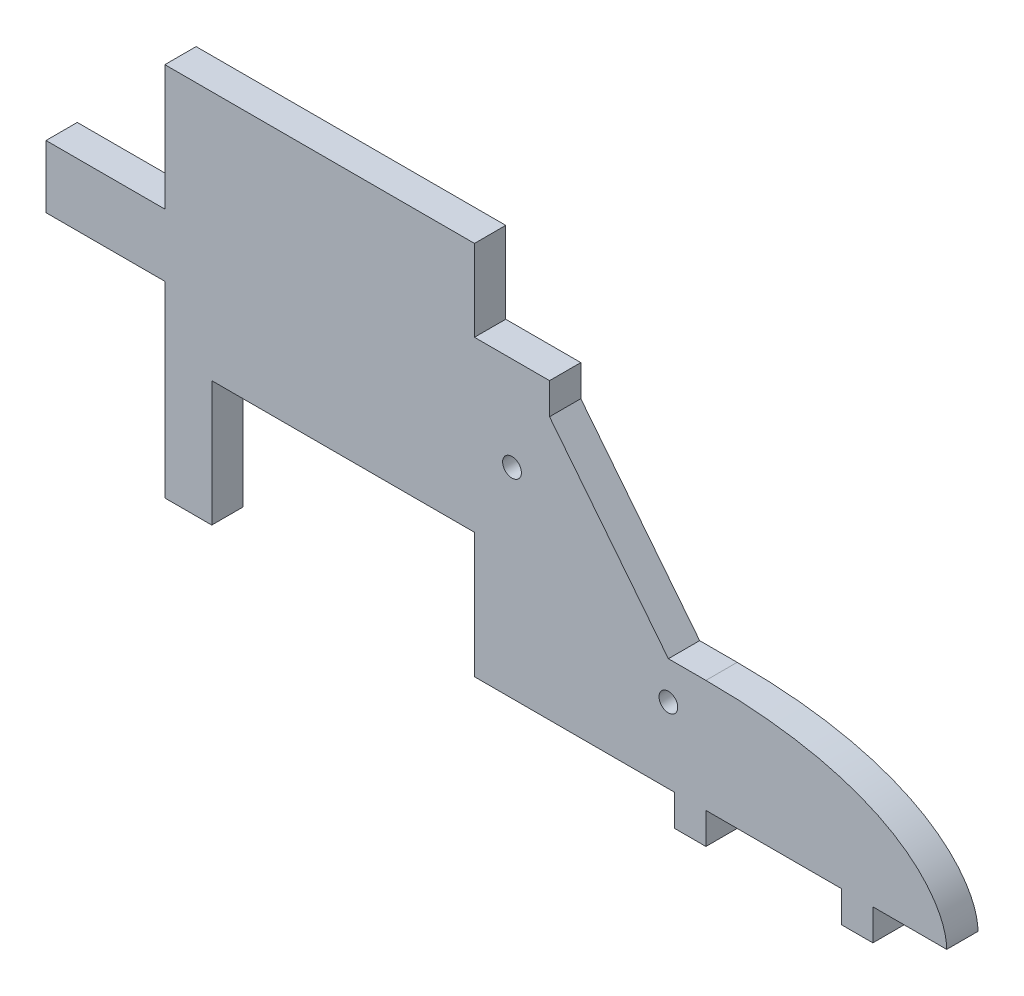
from build123d import *

# Parameters (mm, degrees)
ESQUISSE1_R             = 1.5
BOSS_EXTRU_1_DEPTH      = 5
BOSS_EXTRU_2_DEPTH      = 5
ESQUISSE3_W             = 236.288260714
ESQUISSE3_H             = 122.224262112
ENL_V_MAT_EXTRU_1_DEPTH = 5


with BuildPart() as part:
    # Esquisse1 → Boss.-Extru.1 (new body)
    with BuildSketch(Plane.XY):
        Polygon((12, 42), (31, 18), (37, 18), (37, 0), (37, -5), (32, -5), (32, 0), (0, 0), (0, 47), (12, 47), align=None)
        with Locations((6, 32)):
            Circle(ESQUISSE1_R, mode=Mode.SUBTRACT)
        with Locations((31, 12)):
            Circle(ESQUISSE1_R, mode=Mode.SUBTRACT)
    extrude(amount=BOSS_EXTRU_1_DEPTH)

    # Esquisse2 → Boss.-Extru.2 (add)
    with BuildSketch(Plane(origin=(0, 0, 0), x_dir=(-1, 0, 0), z_dir=(0, 0, -1))):
        with BuildLine():
            Line((-37, 0), (-58.692151967, 0))
            Line((-58.692151967, 0), (-58.692151967, -5))
            Line((-58.692151967, -5), (-63.692151967, -5))
            Line((-63.692151967, -5), (-63.692151967, 0))
            Line((-63.692151967, 0), (-75.5, 0))
            add(Edge.make_bspline(
                [(-75.5, 0), (-75.5, 5.982232529), (-67.685409636, 18), (-37, 18)],
                knots=[0, 0, 0, 0, 1, 1, 1, 1], degree=3))
            Line((-37, 18), (-37, 0))
        make_face()
        Polygon((42, 0), (49.5, 0), (49.5, 30), (68.5, 30), (68.5, 40), (49.5, 40), (49.5, 110), (68.5, 110), (68.5, 120), (49.5, 120), (49.5, 142), (-1, 142), (-1, 167), (-10, 167), (-10, 172), (-20, 172), (-20, 167), (-25, 167), (-25, 90), (20, 90), (20, 60), (0, 60), (0, 20), (42, 20), align=None)
    extrude(amount=-BOSS_EXTRU_2_DEPTH)

    # Esquisse3 → Enlèv. mat.-Extru.1 (cut)
    with BuildSketch(Plane(origin=(0, 0, 0), x_dir=(-1, 0, 0), z_dir=(0, 0, -1))):
        with Locations((68.98963671, 121.112131056)):
            Rectangle(ESQUISSE3_W, ESQUISSE3_H)
    extrude(amount=-ENL_V_MAT_EXTRU_1_DEPTH, mode=Mode.SUBTRACT)


solid = part.part
